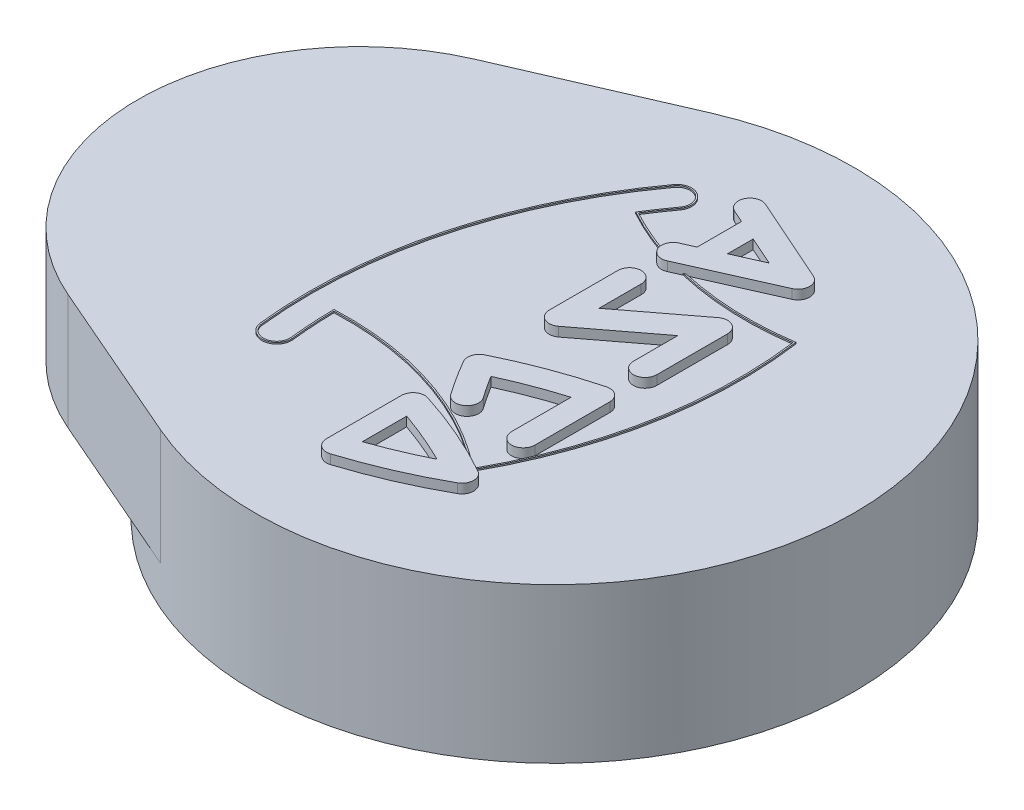
from build123d import *

# Parameters (mm, degrees)
SKETCH1_R           = 6.5151
BOSS_EXTRUDE1_DEPTH = 3.3676
BOSS_EXTRUDE2_START = 2.5146
BOSS_EXTRUDE2_DEPTH = 2.5146
BOSS_EXTRUDE3_DEPTH = 0.03175
BOSS_EXTRUDE4_START = 0.2032
BOSS_EXTRUDE4_DEPTH = 0.2032
BOSS_EXTRUDE5_DEPTH = 0.2032
BOSS_EXTRUDE6_DEPTH = 0.2032
BOSS_EXTRUDE7_START = 0.2032
BOSS_EXTRUDE7_DEPTH = 0.2032


with BuildPart() as part:
    # Sketch1 → Boss-Extrude1 (new body)
    with BuildSketch(Plane(origin=(0, 10.383607632, 0), x_dir=(-1, 0, 0), z_dir=(0, -1, 0))):
        with Locations((-86.1568, 0.188358884)):
            Circle(SKETCH1_R)
    extrude(amount=BOSS_EXTRUDE1_DEPTH)

    # Sketch2 → Boss-Extrude2 (add)
    with BuildSketch(Plane(origin=(0, 7.869007632, 0), x_dir=(1, 0, 0), z_dir=(0, 1, 0)).offset(BOSS_EXTRUDE2_START)):
        with BuildLine():
            Line((83.562463772, 6.164640968), (79.993269461, 4.615234502))
            ThreePointArc((79.993269461, 4.615234502), (77.089, 0.188358884), (79.993269461, -4.238516734))
            Line((79.993269461, -4.238516734), (83.562463772, -5.7879232))
            ThreePointArc((83.562463772, -5.7879232), (92.6719, 0.188358884), (83.562463772, 6.164640968))
        make_face()
    extrude(amount=-BOSS_EXTRUDE2_DEPTH)

    # Sketch3 → Boss-Extrude3 (add)
    with BuildSketch(Plane(origin=(0, 10.415357632, 0), x_dir=(1, 0, 0), z_dir=(0, 1, 0))):
        with BuildLine():
            Line((86.379362148, 2.834929745), (86.331172499, 2.813512123))
            ThreePointArc((86.331172499, 2.813512123), (87.57388973, 2.642364143), (88.826675515, 2.706905023))
            ThreePointArc((88.826675515, 2.706905023), (88.743147222, -0.307968876), (87.717246323, -3.144158035))
            ThreePointArc((87.717246323, -3.144158035), (85.599615489, -1.990016157), (83.209989222, -1.664301363))
            ThreePointArc((83.209989222, -1.664301363), (83.226670097, -2.157743319), (83.268922831, -2.649655834))
            ThreePointArc((83.268922831, -2.649655834), (83.013982099, -2.96896843), (82.694669503, -2.714027698))
            ThreePointArc((82.694669503, -2.714027698), (82.970684724, 1.003656964), (84.577363687, 4.367575269))
            ThreePointArc((84.577363687, 4.367575269), (84.981125023, 4.430281687), (85.043831441, 4.026520351))
            ThreePointArc((85.043831441, 4.026520351), (84.845175329, 3.744205128), (84.656890151, 3.45486998))
            ThreePointArc((84.656890151, 3.45486998), (85.187045427, 3.19462014), (85.738141542, 2.982281574))
            ThreePointArc((85.738141542, 2.982281574), (85.741341744, 2.997904944), (85.745516089, 3.013296689))
            ThreePointArc((85.745516089, 3.013296689), (85.213902251, 3.217551458), (84.701749715, 3.466615834))
            ThreePointArc((84.701749715, 3.466615834), (84.880937437, 3.740370401), (85.069461538, 4.00778107))
            ThreePointArc((85.069461538, 4.00778107), (84.999864331, 4.455911764), (84.551733629, 4.386314602))
            ThreePointArc((84.551733629, 4.386314602), (82.940000597, 1.01181459), (82.663117122, -2.717564614))
            ThreePointArc((82.663117122, -2.717564614), (83.017519015, -3.000520811), (83.300475212, -2.646118918))
            ThreePointArc((83.300475212, -2.646118918), (83.259289868, -2.171130031), (83.242027928, -1.694671533))
            ThreePointArc((83.242027928, -1.694671533), (85.576128395, -2.015738406), (87.651108795, -3.131787359))
            ThreePointArc((87.651108795, -3.131787359), (87.69360158, -3.153679255), (87.735992687, -3.175767397))
            ThreePointArc((87.735992687, -3.175767397), (88.775617442, -0.307140697), (88.853849034, 2.743059067))
            ThreePointArc((88.853849034, 2.743059067), (87.612284437, 2.672606475), (86.379362148, 2.834929745))
        make_face()
    extrude(amount=-BOSS_EXTRUDE3_DEPTH)

    # Sketch4 → Boss-Extrude4 (add)
    with BuildSketch(Plane(origin=(0, 10.383607632, 0), x_dir=(1, 0, 0), z_dir=(0, 1, 0)).offset(BOSS_EXTRUDE4_START)):
        with BuildLine():
            Line((87.971211641, 4.006634675), (86.091611641, 4.842012453))
            ThreePointArc((86.091611641, 4.842012453), (85.756344283, 4.713063514), (85.8852933, 4.377796186))
            Line((85.8852933, 4.377796186), (86.1568, 4.257126542))
            Line((86.1568, 4.257126542), (86.1568, 3.291926542))
            Line((86.1568, 3.291926542), (85.8852933, 3.171256897))
            ThreePointArc((85.8852933, 3.171256897), (85.756344337, 2.835989594), (86.091611641, 2.707040631))
            Line((86.091611641, 2.707040631), (87.971211641, 3.542418409))
            ThreePointArc((87.971211641, 3.542418409), (88.12205247, 3.774526542), (87.971211641, 4.006634675))
        make_face()
        Polygon((87.24265, 3.774526542), (86.614, 4.053926542), (86.614, 3.495126542), align=None, mode=Mode.SUBTRACT)
    extrude(amount=-BOSS_EXTRUDE4_DEPTH)

    # Sketch5 → Boss-Extrude5 (add)
    with BuildSketch(Plane(origin=(0, 10.383607632, 0), x_dir=(1, 0, 0), z_dir=(0, 1, 0))):
        with BuildLine():
            Line((88.12205247, 0.447338975), (88.12205247, 1.988743646))
            ThreePointArc((88.12205247, 1.988743646), (87.980866694, 2.216315505), (87.714265455, 2.19089595))
            Line((87.714265455, 2.19089595), (86.24245247, 1.071216772))
            Line((86.24245247, 1.071216772), (86.24245247, 1.988743646))
            ThreePointArc((86.24245247, 1.988743646), (85.98845247, 2.242743706), (85.73445247, 1.988743646))
            Line((85.73445247, 1.988743646), (85.73445247, 0.495012101))
            ThreePointArc((85.73445247, 0.495012101), (85.875638247, 0.267440242), (86.142239485, 0.292859797))
            Line((86.142239485, 0.292859797), (87.61405247, 1.412538975))
            Line((87.61405247, 1.412538975), (87.61405247, 0.447338975))
            ThreePointArc((87.61405247, 0.447338975), (87.86805247, 0.193338975), (88.12205247, 0.447338975))
        make_face()
    extrude(amount=BOSS_EXTRUDE5_DEPTH)

    # Sketch6 → Boss-Extrude6 (add)
    with BuildSketch(Plane(origin=(0, 10.383607632, 0), x_dir=(1, 0, 0), z_dir=(0, 1, 0))):
        with BuildLine():
            Line((88.12205247, -2.20349139), (88.12205247, -0.573641116))
            ThreePointArc((88.12205247, -0.573641116), (88.022972158, -0.372355522), (87.803029713, -0.328104884))
            ThreePointArc((87.803029713, -0.328104884), (86.82154331, -0.641121728), (85.876084624, -1.050270813))
            ThreePointArc((85.876084624, -1.050270813), (85.745367006, -1.204405708), (85.76854522, -1.405172817))
            ThreePointArc((85.76854522, -1.405172817), (86.002778478, -1.790740386), (86.25361081, -2.165721333))
            ThreePointArc((86.25361081, -2.165721333), (86.607396093, -2.227914435), (86.669589172, -1.874129148))
            ThreePointArc((86.669589172, -1.874129148), (86.505953581, -1.633172635), (86.349528836, -1.387473738))
            ThreePointArc((86.349528836, -1.387473738), (86.973563185, -1.12669528), (87.61405247, -0.909444852))
            Line((87.61405247, -0.909444852), (87.61405247, -2.20349139))
            ThreePointArc((87.61405247, -2.20349139), (87.86805247, -2.45749139), (88.12205247, -2.20349139))
        make_face()
    extrude(amount=BOSS_EXTRUDE6_DEPTH)

    # Sketch7 → Boss-Extrude7 (add)
    with BuildSketch(Plane(origin=(0, 10.383607632, 0), x_dir=(1, 0, 0), z_dir=(0, 1, 0)).offset(BOSS_EXTRUDE7_START)):
        with BuildLine():
            Line((85.73445247, -2.721325206), (85.73445247, -4.351175481))
            ThreePointArc((85.73445247, -4.351175481), (85.838455656, -4.55615586), (86.065294641, -4.593273149))
            ThreePointArc((86.065294641, -4.593273149), (87.050038854, -4.224609495), (87.992239729, -3.75782093))
            ThreePointArc((87.992239729, -3.75782093), (88.12205247, -3.536250363), (87.992239763, -3.314679777))
            ThreePointArc((87.992239763, -3.314679777), (87.050038872, -2.8478912), (86.065294641, -2.479227539))
            ThreePointArc((86.065294641, -2.479227539), (85.838455656, -2.516344828), (85.73445247, -2.721325206))
        make_face()
        with BuildLine():
            Line((86.1822, -3.053650344), (86.1822, -4.018850344))
            ThreePointArc((86.1822, -4.018850344), (86.761323847, -3.795601976), (87.325204148, -3.536250344))
            ThreePointArc((87.325204148, -3.536250344), (86.761323847, -3.276898711), (86.1822, -3.053650344))
        make_face(mode=Mode.SUBTRACT)
    extrude(amount=-BOSS_EXTRUDE7_DEPTH)


solid = part.part
